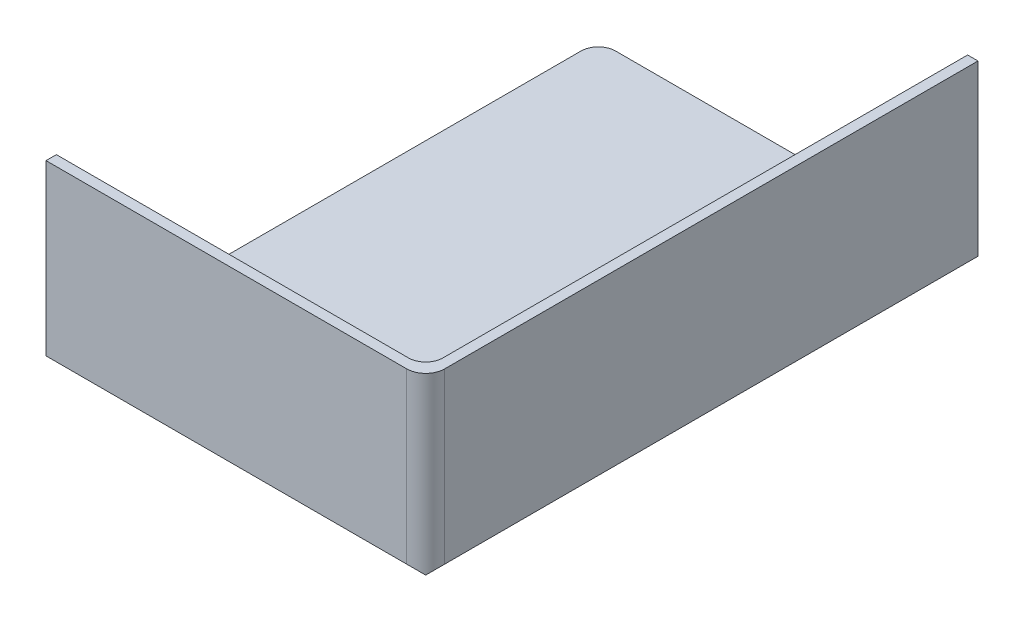
from build123d import *

# Parameters (mm, degrees)
SKETCH_1_W      = 110
SKETCH_1_H      = 160
EXTRUDE_1_DEPTH = 3
EXTRUDE_2_DEPTH = 50
FILLET_1_R      = 5
CHAMFER_1_SIZE  = 4
FILLET_2_R      = 5
FILLET_3_R      = 5
FILLET_4_R      = 5.5


with BuildPart() as part:
    # 草图1 → 凸台-拉伸1 (new body)
    with BuildSketch(Plane(origin=(0, 0, 0), x_dir=(1, 0, 0), z_dir=(0, 1, 0))):
        with Locations((55, 80)):
            Rectangle(SKETCH_1_W, SKETCH_1_H)
    extrude(amount=EXTRUDE_1_DEPTH)

    # 草图2 → 凸台-拉伸2 (add)
    with BuildSketch(Plane(origin=(0, 3, 0), x_dir=(1, 0, 0), z_dir=(0, 1, 0))):
        Polygon((0, 0), (110, 0), (110, 3), (110, 160), (107, 160), (107, 3), (0, 3), align=None)
    extrude(amount=EXTRUDE_2_DEPTH)

    # 圆角1
    fillet_1_edges = [part.edges().sort_by_distance(p)[0] for p in [
        (107, 3, -81.5),
        (53.5, 3, -3),
    ]]
    fillet(fillet_1_edges, radius=FILLET_1_R)

    # 倒角1
    chamfer_1_edges = [part.edges().sort_by_distance(p)[0] for p in [
        (110, 0, -80),
        (55, 0, 0),
    ]]
    chamfer(chamfer_1_edges, length=CHAMFER_1_SIZE)

    # 圆角2
    fillet_2_edges = [part.edges().sort_by_distance(p)[0] for p in [
        (0, 1.5, -160),
    ]]
    fillet(fillet_2_edges, radius=FILLET_2_R)

    # 圆角3
    # the kernel refuses this fillet: 5 mm, written as the material it adds along each edge
    with BuildSketch(Plane(origin=(102, 8, -8), x_dir=(0, 0, 1), z_dir=(1, 0, 0))) as fillet_3_piece_1_section:
        Polygon((0, 0), (FILLET_3_R, 0), (FILLET_3_R, FILLET_3_R), (0, FILLET_3_R), align=None)
    fillet_3_piece_1 = extrude(amount=FILLET_3_R, mode=Mode.PRIVATE)
    fillet_3_piece_1 = fillet_3_piece_1 - Plane(origin=(102, 8, -8), x_dir=(0, 0.7071067811865475, -0.7071067811865475), z_dir=(1, 0, 0)) * Sphere(FILLET_3_R, mode=Mode.PRIVATE)
    add(fillet_3_piece_1)
    with BuildSketch(Plane(origin=(107, 8, -3), x_dir=(0, 0, -1), z_dir=(0, 1, 0))) as fillet_3_piece_2:
        with BuildLine():
            CenterArc((FILLET_3_R, FILLET_3_R), FILLET_3_R, 180, 90)
            Line((0, FILLET_3_R), (0, 0))
            Line((0, 0), (FILLET_3_R, 0))
        make_face()
    extrude(amount=45)

    # 圆角4
    fillet_4_edges = [part.edges().sort_by_distance(p)[0] for p in [
        (110, 28.5, 0),
    ]]
    fillet(fillet_4_edges, radius=FILLET_4_R)


solid = part.part
